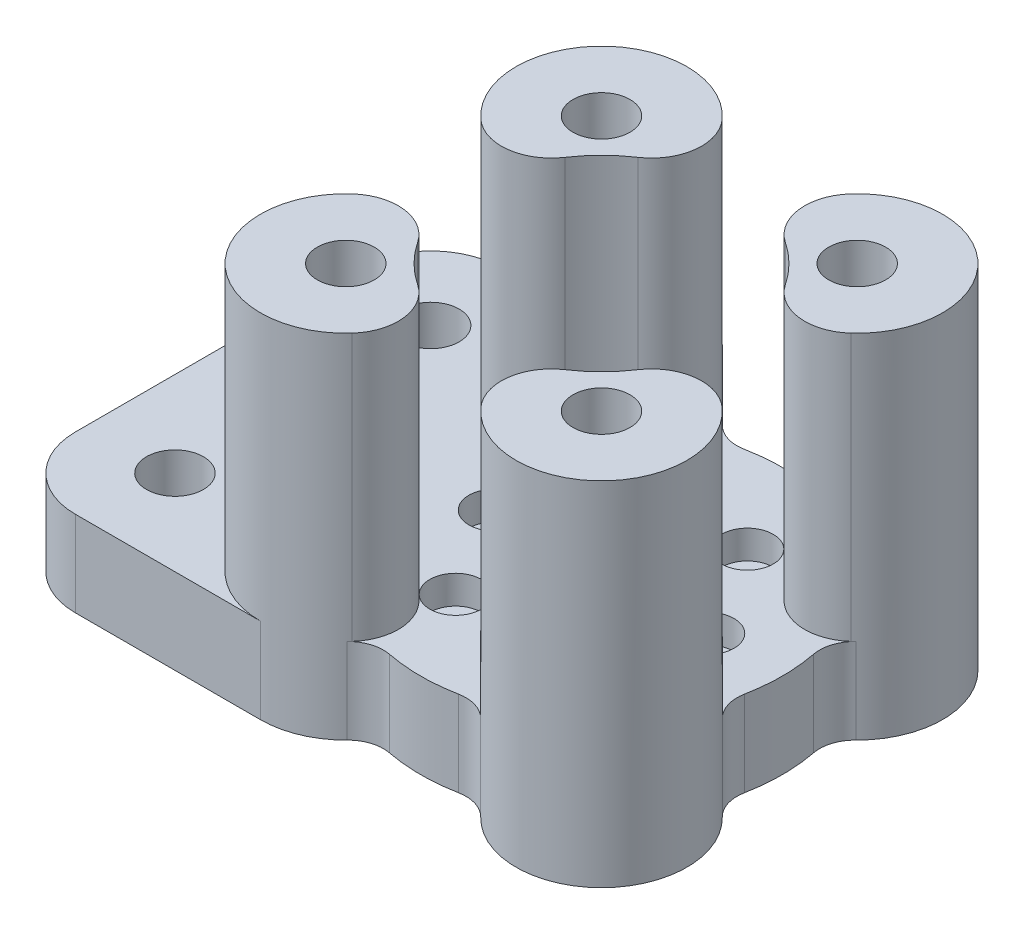
from build123d import *

# Parameters (mm, degrees)
SKETCH1_R                = 4
SKETCH1_R_2              = 10.5
SKETCH1_R_3              = 2
BASE_DEPTH               = 12
SKETCH2_R                = 3.625
BOLT_HEAD_RECESSES_DEPTH = 4
SKETCH3_R                = 4
LEGS_DEPTH               = 37.5
FILLET2_R                = 7
SKETCH4_R                = 7
M8_COUNTERBORE_DEPTH     = 8


with BuildPart() as part:
    # Sketch1 → base (new body)
    with BuildSketch(Plane(origin=(0, 0, 0), x_dir=(1, 0, 0), z_dir=(0, 1, 0))):
        with BuildLine():
            Line((-17.960512242, 29.960512242), (-43.960512242, 29.960512242))
            ThreePointArc((-43.960512242, 29.960512242), (-51.031580054, 27.031580054), (-53.960512242, 19.960512242))
            Line((-53.960512242, 19.960512242), (-53.960512242, -19.960512242))
            ThreePointArc((-53.960512242, -19.960512242), (-51.031580054, -27.031580054), (-43.960512242, -29.960512242))
            Line((-43.960512242, -29.960512242), (-17.960512242, -29.960512242))
            ThreePointArc((-17.960512242, -29.960512242), (-13.304198931, -29.020292816), (-9.377544991, -26.346969967))
            ThreePointArc((-9.377544991, -26.346969967), (-7.290769599, -25.068329757), (-4.847146031, -24.9332143))
            ThreePointArc((-4.847146031, -24.9332143), (0, -25.4), (4.847146031, -24.9332143))
            ThreePointArc((4.847146031, -24.9332143), (7.290769599, -25.068329757), (9.377544991, -26.346969967))
            ThreePointArc((9.377544991, -26.346969967), (26.445793616, -26.445793616), (26.346969967, -9.377544991))
            ThreePointArc((26.346969967, -9.377544991), (25.068329757, -7.290769599), (24.9332143, -4.847146031))
            ThreePointArc((24.9332143, -4.847146031), (25.4, 0), (24.9332143, 4.847146031))
            ThreePointArc((24.9332143, 4.847146031), (25.068329757, 7.290769599), (26.346969967, 9.377544991))
            ThreePointArc((26.346969967, 9.377544991), (26.445793616, 26.445793616), (9.377544991, 26.346969967))
            ThreePointArc((9.377544991, 26.346969967), (7.290769599, 25.068329757), (4.847146031, 24.9332143))
            ThreePointArc((4.847146031, 24.9332143), (0, 25.4), (-4.847146031, 24.9332143))
            ThreePointArc((-4.847146031, 24.9332143), (-7.290769599, 25.068329757), (-9.377544991, 26.346969967))
            ThreePointArc((-9.377544991, 26.346969967), (-13.304198931, 29.020292816), (-17.960512242, 29.960512242))
        make_face()
        with Locations((-17.960512242, 17.960512242)):
            Circle(SKETCH1_R, mode=Mode.SUBTRACT)
        with Locations((17.960512242, 17.960512242)):
            Circle(SKETCH1_R, mode=Mode.SUBTRACT)
        with Locations((17.960512242, -17.960512242)):
            Circle(SKETCH1_R, mode=Mode.SUBTRACT)
        with Locations((-17.960512242, -17.960512242)):
            Circle(SKETCH1_R, mode=Mode.SUBTRACT)
        Circle(SKETCH1_R_2, mode=Mode.SUBTRACT)
        with Locations((-7.5, 12.990381057)):
            Circle(SKETCH1_R_3, mode=Mode.SUBTRACT)
        with Locations((7.5, 12.990381057)):
            Circle(SKETCH1_R_3, mode=Mode.SUBTRACT)
        with Locations((15, 0)):
            Circle(SKETCH1_R_3, mode=Mode.SUBTRACT)
        with Locations((7.5, -12.990381057)):
            Circle(SKETCH1_R_3, mode=Mode.SUBTRACT)
        with Locations((-7.5, -12.990381057)):
            Circle(SKETCH1_R_3, mode=Mode.SUBTRACT)
        with Locations((-15, 0)):
            Circle(SKETCH1_R_3, mode=Mode.SUBTRACT)
        with Locations((-41.960512242, 17.960512242)):
            Circle(SKETCH1_R, mode=Mode.SUBTRACT)
        with Locations((-41.960512242, -17.960512242)):
            Circle(SKETCH1_R, mode=Mode.SUBTRACT)
    extrude(amount=BASE_DEPTH)

    # Sketch2 → bolt head recesses (cut)
    with BuildSketch(Plane(origin=(0, 12, 0), x_dir=(1, 0, 0), z_dir=(0, 1, 0))):
        with Locations((-7.5, 12.990381057)):
            Circle(SKETCH2_R)
        with Locations((7.5, 12.990381057)):
            Circle(SKETCH2_R)
        with Locations((15, 0)):
            Circle(SKETCH2_R)
        with Locations((7.5, -12.990381057)):
            Circle(SKETCH2_R)
        with Locations((-7.5, -12.990381057)):
            Circle(SKETCH2_R)
        with Locations((-15, 0)):
            Circle(SKETCH2_R)
    extrude(amount=-BOLT_HEAD_RECESSES_DEPTH, mode=Mode.SUBTRACT)

    # Sketch3 → legs (add)
    # profile 1 of 4: a face of its own
    with BuildSketch(Plane(origin=(0, 12, 0), x_dir=(1, 0, 0), z_dir=(0, 1, 0))):
        with BuildLine():
            ThreePointArc((-17.64406852, -5.964685327), (-26.445793616, -26.445793616), (-5.964685327, -17.64406852))
            ThreePointArc((-5.964685327, -17.64406852), (-13.1698638, -13.1698638), (-17.64406852, -5.964685327))
        make_face()
        with Locations((-17.960512242, -17.960512242)):
            Circle(SKETCH3_R, mode=Mode.SUBTRACT)
    # profile 2 of 4: a face of its own
    with BuildSketch(Plane(origin=(0, 12, 0), x_dir=(1, 0, 0), z_dir=(0, 1, 0))):
        with BuildLine():
            ThreePointArc((-5.964685327, 17.64406852), (-26.445793616, 26.445793616), (-17.64406852, 5.964685327))
            ThreePointArc((-17.64406852, 5.964685327), (-13.1698638, 13.1698638), (-5.964685327, 17.64406852))
        make_face()
        with Locations((-17.960512242, 17.960512242)):
            Circle(SKETCH3_R, mode=Mode.SUBTRACT)
    # profile 3 of 4: a face of its own
    with BuildSketch(Plane(origin=(0, 12, 0), x_dir=(1, 0, 0), z_dir=(0, 1, 0))):
        with BuildLine():
            ThreePointArc((17.64406852, 5.964685327), (26.445793616, 26.445793616), (5.964685327, 17.64406852))
            ThreePointArc((5.964685327, 17.64406852), (13.1698638, 13.1698638), (17.64406852, 5.964685327))
        make_face()
        with Locations((17.960512242, 17.960512242)):
            Circle(SKETCH3_R, mode=Mode.SUBTRACT)
    # profile 4 of 4: a face of its own
    with BuildSketch(Plane(origin=(0, 12, 0), x_dir=(1, 0, 0), z_dir=(0, 1, 0))):
        with BuildLine():
            ThreePointArc((5.964685327, -17.64406852), (26.445793616, -26.445793616), (17.64406852, -5.964685327))
            ThreePointArc((17.64406852, -5.964685327), (13.1698638, -13.1698638), (5.964685327, -17.64406852))
        make_face()
        with Locations((17.960512242, -17.960512242)):
            Circle(SKETCH3_R, mode=Mode.SUBTRACT)
    extrude(amount=LEGS_DEPTH)

    # Fillet2
    fillet2_edges = [part.edges().sort_by_distance(p)[0] for p in [
        (-5.964685327, 30.75, 17.64406852),
        (-17.64406852, 30.75, 5.964685327),
        (5.964685327, 30.75, 17.64406852),
        (17.64406852, 30.75, 5.964685327),
        (5.964685327, 30.75, -17.64406852),
        (17.64406852, 30.75, -5.964685327),
        (-5.964685327, 30.75, -17.64406852),
        (-17.64406852, 30.75, -5.964685327),
    ]]
    fillet(fillet2_edges, radius=FILLET2_R)

    # Sketch4 → m8 counterbore (cut)
    with BuildSketch(Plane.XZ):
        with Locations((17.960512242, 17.960512242)):
            Circle(SKETCH4_R)
        with Locations((17.960512242, -17.960512242)):
            Circle(SKETCH4_R)
        with Locations((-17.960512242, -17.960512242)):
            Circle(SKETCH4_R)
        with Locations((-17.960512242, 17.960512242)):
            Circle(SKETCH4_R)
    extrude(amount=-M8_COUNTERBORE_DEPTH, mode=Mode.SUBTRACT)


solid = part.part
